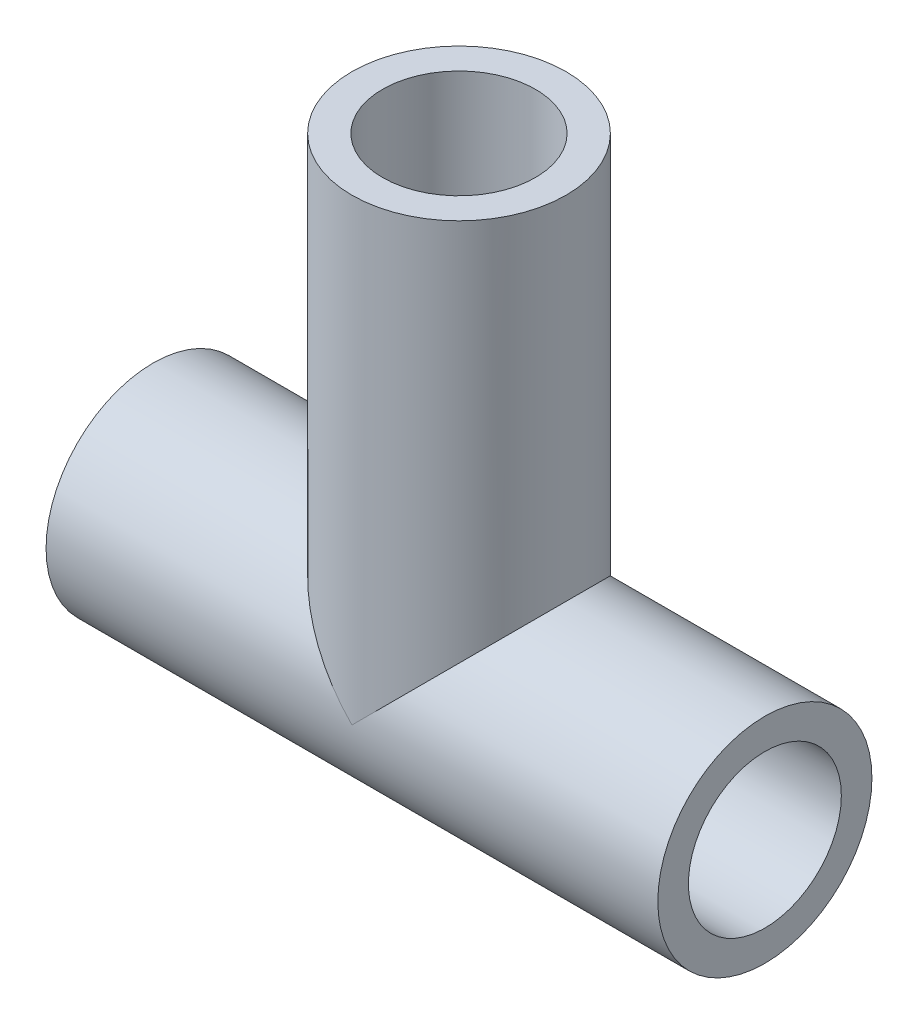
from build123d import *

# Parameters (mm, degrees)
SKETCH1_R           = 4.445
BOSS_EXTRUDE1_DEPTH = 25.4
SKETCH2_R           = 4.445
BOSS_EXTRUDE2_DEPTH = 19.05
SKETCH3_R           = 3.175
CUT_EXTRUDE1_DEPTH  = 33.059640126
CUT_EXTRUDE2_REACH  = 36.885
SKETCH4_R           = 3.175


with BuildPart() as part:
    # Sketch1 → Boss-Extrude1 (new body)
    with BuildSketch(Plane(origin=(0, 0, 0), x_dir=(0, 0, -1), z_dir=(1, 0, 0))):
        Circle(SKETCH1_R)
    extrude(amount=BOSS_EXTRUDE1_DEPTH)

    # Sketch2 → Boss-Extrude2 (add)
    with BuildSketch(Plane(origin=(0, 0, 0), x_dir=(1, 0, 0), z_dir=(0, 1, 0))):
        with Locations((12.7, 0)):
            Circle(SKETCH2_R)
    extrude(amount=BOSS_EXTRUDE2_DEPTH)

    # Sketch3 → Cut-Extrude1 (cut, through all)
    with BuildSketch(Plane(origin=(25.4, 0, 0), x_dir=(0, 0, -1), z_dir=(1, 0, 0))):
        Circle(SKETCH3_R)
    extrude(amount=-CUT_EXTRUDE1_DEPTH, mode=Mode.SUBTRACT)

    # Sketch4 → Cut-Extrude2 (cut, up to next)
    with BuildSketch(Plane(origin=(0, 19.05, 0), x_dir=(1, 0, 0), z_dir=(0, 1, 0)), mode=Mode.PRIVATE) as cut_extrude2_sk1:
        with Locations((12.7, 0)):
            Circle(SKETCH4_R)
    cut_extrude2_tool1 = extrude(cut_extrude2_sk1.sketch, amount=-CUT_EXTRUDE2_REACH, mode=Mode.PRIVATE) & part.part
    add(cut_extrude2_tool1.solids().sort_by_distance((12.7, 19.05, 0))[0], mode=Mode.SUBTRACT)


solid = part.part
